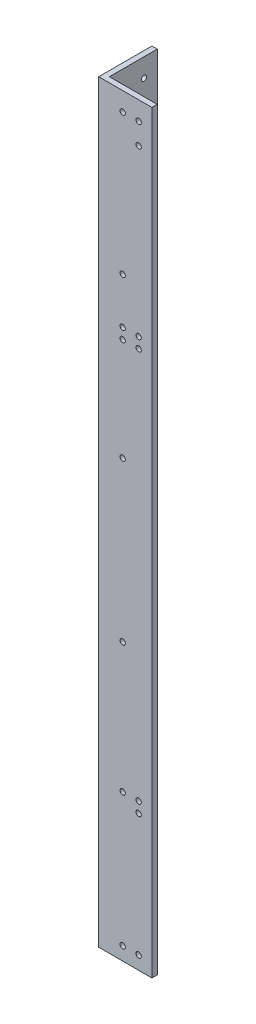
from build123d import *

# Parameters (mm, degrees)
BOSS_EXTRUDE1_DEPTH               = 450
BACKSIDEHOLES_SKETCH3_R           = 1.5875
BACKSIDEHOLES_CUT_EXTRUDE1_DEPTH  = 3.175
RIGHTSIDEHOLES_SKETCH4_R          = 1.5875
RIGHTSIDEHOLES_CUT_EXTRUDE2_DEPTH = 3.175


with BuildPart() as part:
    # Sketch2 → Boss-Extrude1 (new body)
    with BuildSketch(Plane(origin=(0, 0, 0), x_dir=(1, 0, 0), z_dir=(0, 1, 0))):
        Polygon((0, 31.75), (3.175, 31.75), (3.175, 3.175), (31.75, 3.175), (31.75, 0), (0, 0), align=None)
    extrude(amount=BOSS_EXTRUDE1_DEPTH)

    # BackSideHoles-Sketch3 → BackSideHoles-Cut-Extrude1 (cut)
    with BuildSketch(Plane.XY):
        with Locations((23.8125, 81.1125)):
            Circle(BACKSIDEHOLES_SKETCH3_R)
        with Locations((14.2875, 87.4625)):
            Circle(BACKSIDEHOLES_SKETCH3_R)
        with Locations((23.8125, 87.4625)):
            Circle(BACKSIDEHOLES_SKETCH3_R)
        with Locations((14.2875, 438.8875)):
            Circle(BACKSIDEHOLES_SKETCH3_R)
        with Locations((23.8125, 438.8875)):
            Circle(BACKSIDEHOLES_SKETCH3_R)
        with Locations((23.8125, 426.1875)):
            Circle(BACKSIDEHOLES_SKETCH3_R)
        with Locations((14.2875, 327.602644)):
            Circle(BACKSIDEHOLES_SKETCH3_R)
        with Locations((23.8125, 327.602644)):
            Circle(BACKSIDEHOLES_SKETCH3_R)
        with Locations((14.2875, 321.252644)):
            Circle(BACKSIDEHOLES_SKETCH3_R)
        with Locations((23.8125, 321.252644)):
            Circle(BACKSIDEHOLES_SKETCH3_R)
        with Locations((14.2875, 165)):
            Circle(BACKSIDEHOLES_SKETCH3_R)
        with Locations((14.2875, 260)):
            Circle(BACKSIDEHOLES_SKETCH3_R)
        with Locations((14.2875, 355)):
            Circle(BACKSIDEHOLES_SKETCH3_R)
        with Locations((14.2875, 7.9375)):
            Circle(BACKSIDEHOLES_SKETCH3_R)
        with Locations((23.8125, 7.9375)):
            Circle(BACKSIDEHOLES_SKETCH3_R)
    extrude(amount=-BACKSIDEHOLES_CUT_EXTRUDE1_DEPTH, mode=Mode.SUBTRACT)

    # RightSideHoles-Sketch4 → RightSideHoles-Cut-Extrude2 (cut)
    with BuildSketch(Plane.ZY):
        with Locations((-23.8125, 81.1125)):
            Circle(RIGHTSIDEHOLES_SKETCH4_R)
        with Locations((-23.8125, 87.4625)):
            Circle(RIGHTSIDEHOLES_SKETCH4_R)
        with Locations((-23.8125, 438.8875)):
            Circle(RIGHTSIDEHOLES_SKETCH4_R)
        with Locations((-14.2875, 426.1875)):
            Circle(RIGHTSIDEHOLES_SKETCH4_R)
        with Locations((-23.8125, 426.1875)):
            Circle(RIGHTSIDEHOLES_SKETCH4_R)
        with Locations((-23.8125, 327.602644)):
            Circle(RIGHTSIDEHOLES_SKETCH4_R)
        with Locations((-14.2875, 327.602644)):
            Circle(RIGHTSIDEHOLES_SKETCH4_R)
        with Locations((-23.8125, 292.677644)):
            Circle(RIGHTSIDEHOLES_SKETCH4_R)
        with Locations((-14.2875, 292.677644)):
            Circle(RIGHTSIDEHOLES_SKETCH4_R)
        with Locations((-23.8125, 7.9375)):
            Circle(RIGHTSIDEHOLES_SKETCH4_R)
        with Locations((-14.2875, 7.9375)):
            Circle(RIGHTSIDEHOLES_SKETCH4_R)
        with Locations((-14.2875, 165)):
            Circle(RIGHTSIDEHOLES_SKETCH4_R)
        with Locations((-14.2875, 260)):
            Circle(RIGHTSIDEHOLES_SKETCH4_R)
        with Locations((-14.2875, 355)):
            Circle(RIGHTSIDEHOLES_SKETCH4_R)
        with Locations((-14.2875, 81.1125)):
            Circle(RIGHTSIDEHOLES_SKETCH4_R)
    extrude(amount=-RIGHTSIDEHOLES_CUT_EXTRUDE2_DEPTH, mode=Mode.SUBTRACT)


solid = part.part
